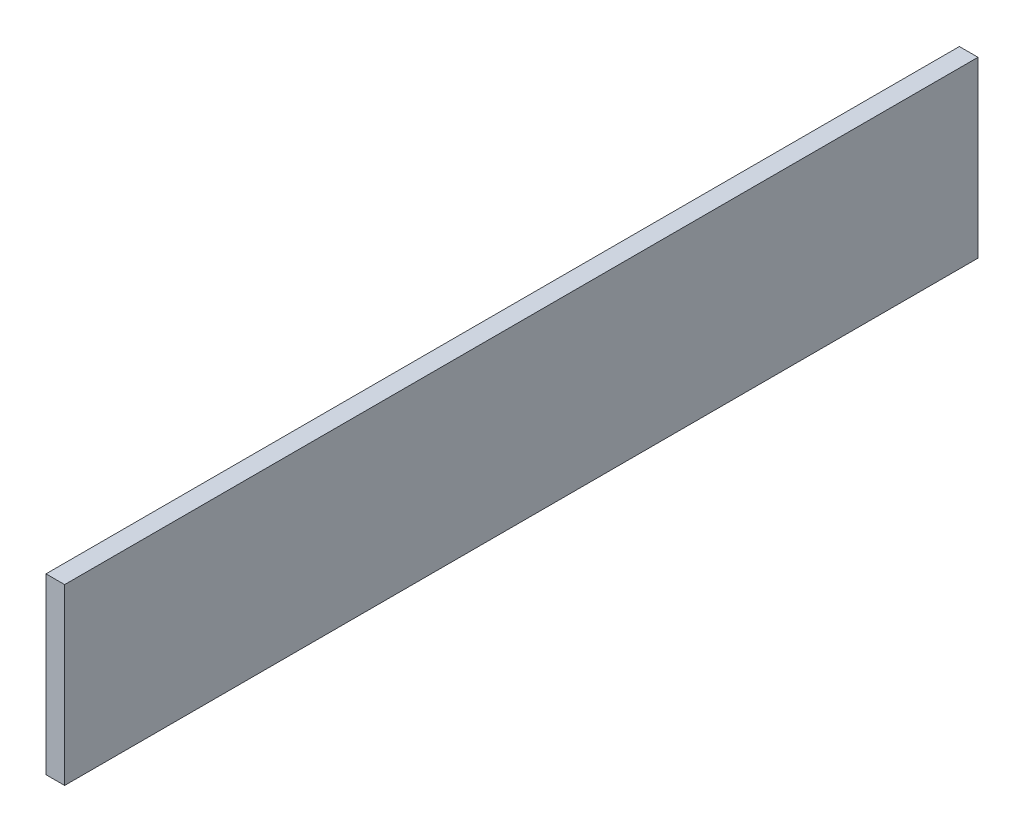
from build123d import *

# Parameters (mm, degrees)
SKETCH1_W          = 147
SKETCH1_H          = 28
BASE_FLANGE1_DEPTH = 3


# Sheet-metal steps are written as plain solids
with BuildPart() as part:
    # Sketch1 → Base-Flange1 (new body)
    with BuildSketch(Plane(origin=(0, 0, 0), x_dir=(0, 0, -1), z_dir=(1, 0, 0))):
        with Locations((73.5, 14)):
            Rectangle(SKETCH1_W, SKETCH1_H)
    extrude(amount=-BASE_FLANGE1_DEPTH)


solid = part.part
